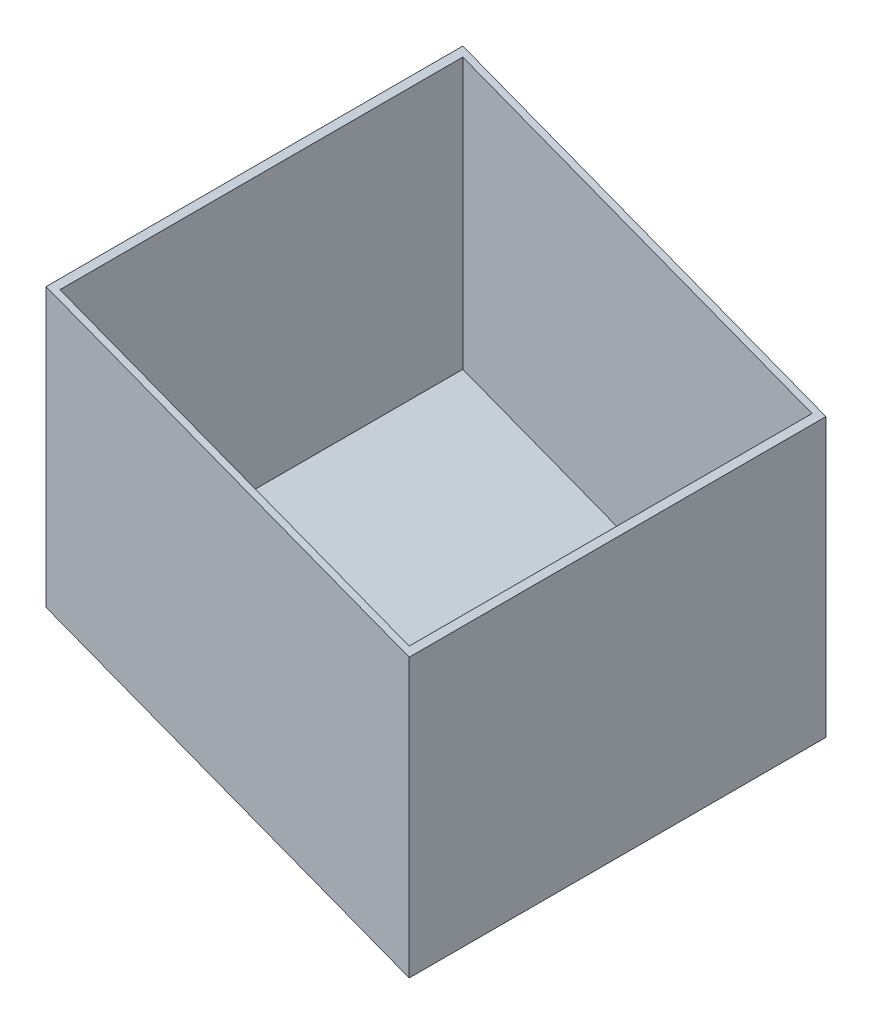
from build123d import *

# Parameters (mm, degrees)
BOSS_EXTRUDE1_DEPTH = 38.1
SHELL1_T            = -1.27


with BuildPart() as part:
    # Sketch1 → Boss-Extrude1 (new, symmetric)
    with BuildSketch(Plane.XY):
        Polygon((-33.198119966, 25.4), (-33.198119966, -25.4), (33.198119966, -50.887128572), (33.198119966, -0.087128572), align=None)
    extrude(amount=BOSS_EXTRUDE1_DEPTH, both=True)

    # Shell1
    shell1_openings = [part.faces().sort_by_distance(p)[0] for p in [
        (0, 12.656435714, 0),
    ]]
    offset(amount=SHELL1_T, openings=shell1_openings, kind=Kind.INTERSECTION)


solid = part.part
